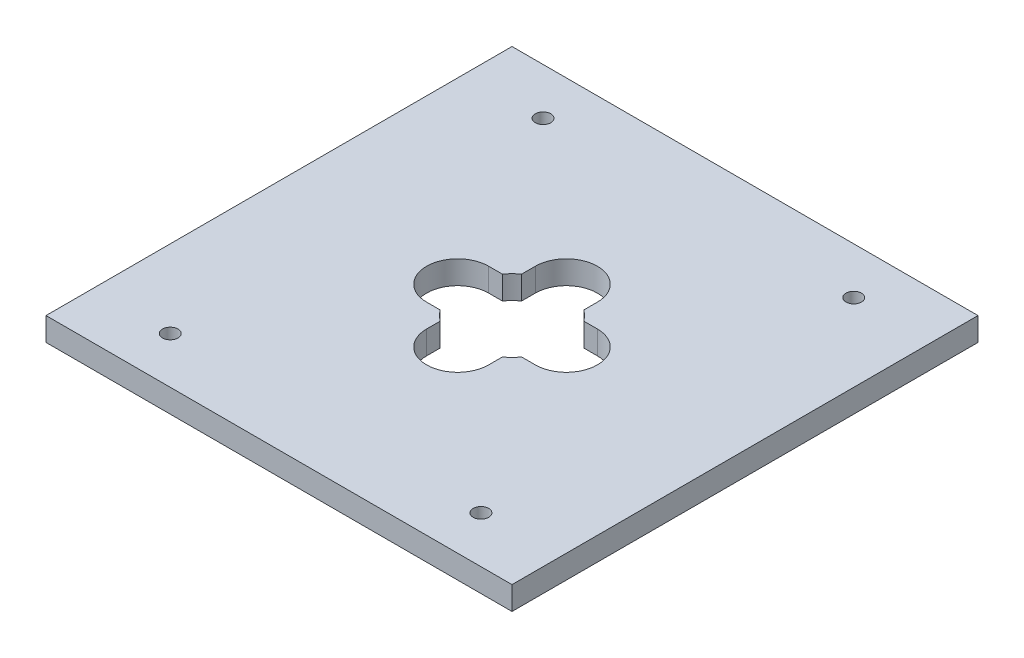
from build123d import *

# Parameters (mm, degrees)
SKETCH1_W           = 60
SKETCH1_H           = 60
BOSS_EXTRUDE1_DEPTH = 3
CUT_EXTRUDE1_DEPTH  = 43.532340636
SKETCH3_R           = 1
CUT_EXTRUDE3_DEPTH  = 43.532340636


with BuildPart() as part:
    # Sketch1 → Boss-Extrude1 (new body)
    with BuildSketch(Plane(origin=(0, 0, 0), x_dir=(1, 0, 0), z_dir=(0, 1, 0))):
        Rectangle(SKETCH1_W, SKETCH1_H)
    extrude(amount=BOSS_EXTRUDE1_DEPTH)

    # Sketch2 → Cut-Extrude1 (cut, through all)
    with BuildSketch(Plane(origin=(0, 3, 0), x_dir=(1, 0, 0), z_dir=(0, 1, 0))):
        with BuildLine():
            Line((-7, 4), (-5.249761899, 4))
            ThreePointArc((-5.249761899, 4), (-4.666904756, 4.666904756), (-4, 5.249761899))
            Line((-4, 5.249761899), (-4, 7))
            ThreePointArc((-4, 7), (0, 11), (4, 7))
            Line((4, 7), (4, 5.249761899))
            ThreePointArc((4, 5.249761899), (4.666904756, 4.666904756), (5.249761899, 4))
            Line((5.249761899, 4), (7, 4))
            ThreePointArc((7, 4), (11, 0), (7, -4))
            Line((7, -4), (5.249761899, -4))
            ThreePointArc((5.249761899, -4), (4.666904756, -4.666904756), (4, -5.249761899))
            Line((4, -5.249761899), (4, -7))
            ThreePointArc((4, -7), (0, -11), (-4, -7))
            Line((-4, -7), (-4, -5.249761899))
            ThreePointArc((-4, -5.249761899), (-4.666904756, -4.666904756), (-5.249761899, -4))
            Line((-5.249761899, -4), (-7, -4))
            ThreePointArc((-7, -4), (-11, 0), (-7, 4))
        make_face()
    extrude(amount=-CUT_EXTRUDE1_DEPTH, mode=Mode.SUBTRACT)

    # Sketch3 → Cut-Extrude3 (cut, through all)
    with BuildSketch(Plane(origin=(0, 3, 0), x_dir=(1, 0, 0), z_dir=(0, 1, 0))):
        with Locations((-20, 24)):
            Circle(SKETCH3_R)
        with Locations((20, 24)):
            Circle(SKETCH3_R)
        with Locations((-20, -24)):
            Circle(SKETCH3_R)
        with Locations((20, -24)):
            Circle(SKETCH3_R)
    extrude(amount=-CUT_EXTRUDE3_DEPTH, mode=Mode.SUBTRACT)


solid = part.part
